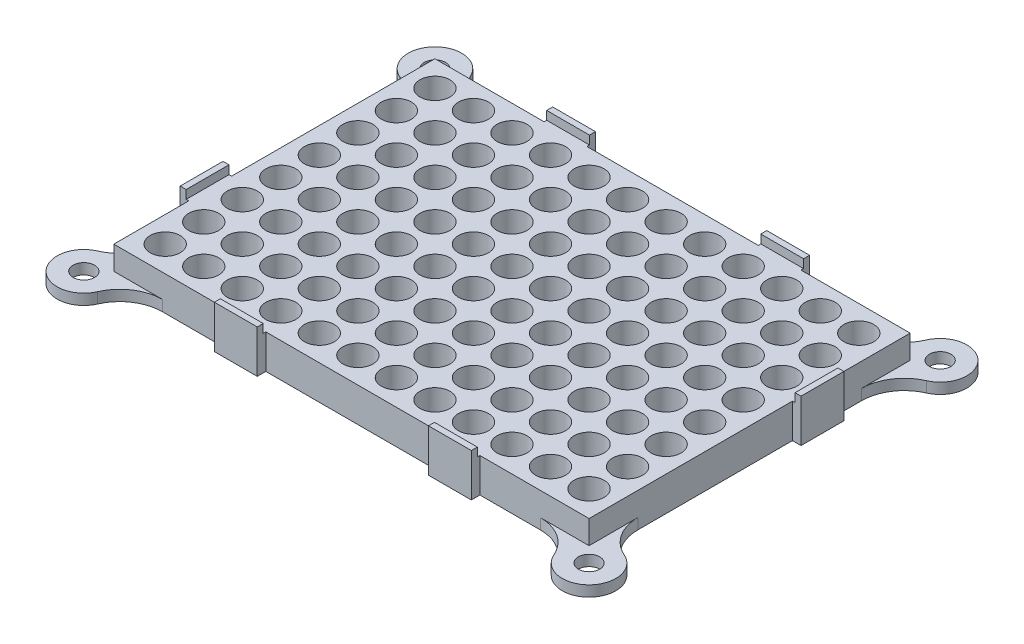
from build123d import *

# Parameters (mm, degrees)
SKETCH3_W              = 111
SKETCH3_H              = 75
SKETCH3_R              = 3.5
WELL_LIGHT_GUIDE_DEPTH = 8
SKETCH1_R              = 2.5
PCB_MOUNT_PLATE_DEPTH  = 2.5
SKETCH4_W              = 10
SKETCH4_H              = 2
SKETCH4_W_2            = 2
SKETCH4_H_2            = 10
TOP_GUIDE_TABS_DEPTH   = 10
SKETCH5_W              = 10
SKETCH5_H              = 0.6
SKETCH5_W_2            = 0.6
SKETCH5_H_2            = 10
F_3DPRINT_SPACER_DEPTH = 158.843672664
FILLET1_R              = 10


with BuildPart() as part:
    # Sketch3 → Well light guide (new body)
    with BuildSketch(Plane(origin=(0, 0, 0), x_dir=(1, 0, 0), z_dir=(0, 1, 0))):
        with Locations((64, 43)):
            Rectangle(SKETCH3_W, SKETCH3_H)
        with Locations(Location((14.5, 74.5, 0), (0, 0, 270))):
            Circle(SKETCH3_R, mode=Mode.SUBTRACT)
        with Locations(Location((23.5, 74.5, 0), (0, 0, 270))):
            Circle(SKETCH3_R, mode=Mode.SUBTRACT)
        with Locations(Location((32.5, 74.5, 0), (0, 0, 270))):
            Circle(SKETCH3_R, mode=Mode.SUBTRACT)
        with Locations(Location((41.5, 74.5, 0), (0, 0, 270))):
            Circle(SKETCH3_R, mode=Mode.SUBTRACT)
        with Locations(Location((50.5, 74.5, 0), (0, 0, 270))):
            Circle(SKETCH3_R, mode=Mode.SUBTRACT)
        with Locations(Location((59.5, 74.5, 0), (0, 0, 270))):
            Circle(SKETCH3_R, mode=Mode.SUBTRACT)
        with Locations(Location((68.5, 74.5, 0), (0, 0, 270))):
            Circle(SKETCH3_R, mode=Mode.SUBTRACT)
        with Locations(Location((77.5, 74.5, 0), (0, 0, 270))):
            Circle(SKETCH3_R, mode=Mode.SUBTRACT)
        with Locations(Location((86.5, 74.5, 0), (0, 0, 270))):
            Circle(SKETCH3_R, mode=Mode.SUBTRACT)
        with Locations(Location((95.5, 74.5, 0), (0, 0, 270))):
            Circle(SKETCH3_R, mode=Mode.SUBTRACT)
        with Locations(Location((104.5, 74.5, 0), (0, 0, 270))):
            Circle(SKETCH3_R, mode=Mode.SUBTRACT)
        with Locations(Location((113.5, 74.5, 0), (0, 0, 270))):
            Circle(SKETCH3_R, mode=Mode.SUBTRACT)
        with Locations(Location((23.5, 65.5, 0), (0, 0, 270))):
            Circle(SKETCH3_R, mode=Mode.SUBTRACT)
        with Locations(Location((32.5, 65.5, 0), (0, 0, 270))):
            Circle(SKETCH3_R, mode=Mode.SUBTRACT)
        with Locations(Location((41.5, 65.5, 0), (0, 0, 270))):
            Circle(SKETCH3_R, mode=Mode.SUBTRACT)
        with Locations(Location((50.5, 65.5, 0), (0, 0, 270))):
            Circle(SKETCH3_R, mode=Mode.SUBTRACT)
        with Locations(Location((59.5, 65.5, 0), (0, 0, 270))):
            Circle(SKETCH3_R, mode=Mode.SUBTRACT)
        with Locations(Location((68.5, 65.5, 0), (0, 0, 270))):
            Circle(SKETCH3_R, mode=Mode.SUBTRACT)
        with Locations(Location((77.5, 65.5, 0), (0, 0, 270))):
            Circle(SKETCH3_R, mode=Mode.SUBTRACT)
        with Locations(Location((86.5, 65.5, 0), (0, 0, 270))):
            Circle(SKETCH3_R, mode=Mode.SUBTRACT)
        with Locations(Location((95.5, 65.5, 0), (0, 0, 270))):
            Circle(SKETCH3_R, mode=Mode.SUBTRACT)
        with Locations(Location((104.5, 65.5, 0), (0, 0, 270))):
            Circle(SKETCH3_R, mode=Mode.SUBTRACT)
        with Locations(Location((113.5, 65.5, 0), (0, 0, 270))):
            Circle(SKETCH3_R, mode=Mode.SUBTRACT)
        with Locations(Location((23.5, 56.5, 0), (0, 0, 270))):
            Circle(SKETCH3_R, mode=Mode.SUBTRACT)
        with Locations(Location((32.5, 56.5, 0), (0, 0, 270))):
            Circle(SKETCH3_R, mode=Mode.SUBTRACT)
        with Locations(Location((41.5, 56.5, 0), (0, 0, 270))):
            Circle(SKETCH3_R, mode=Mode.SUBTRACT)
        with Locations(Location((50.5, 56.5, 0), (0, 0, 270))):
            Circle(SKETCH3_R, mode=Mode.SUBTRACT)
        with Locations(Location((59.5, 56.5, 0), (0, 0, 270))):
            Circle(SKETCH3_R, mode=Mode.SUBTRACT)
        with Locations(Location((68.5, 56.5, 0), (0, 0, 270))):
            Circle(SKETCH3_R, mode=Mode.SUBTRACT)
        with Locations(Location((77.5, 56.5, 0), (0, 0, 270))):
            Circle(SKETCH3_R, mode=Mode.SUBTRACT)
        with Locations(Location((86.5, 56.5, 0), (0, 0, 270))):
            Circle(SKETCH3_R, mode=Mode.SUBTRACT)
        with Locations(Location((95.5, 56.5, 0), (0, 0, 270))):
            Circle(SKETCH3_R, mode=Mode.SUBTRACT)
        with Locations(Location((104.5, 56.5, 0), (0, 0, 270))):
            Circle(SKETCH3_R, mode=Mode.SUBTRACT)
        with Locations(Location((113.5, 56.5, 0), (0, 0, 270))):
            Circle(SKETCH3_R, mode=Mode.SUBTRACT)
        with Locations(Location((23.5, 47.5, 0), (0, 0, 270))):
            Circle(SKETCH3_R, mode=Mode.SUBTRACT)
        with Locations(Location((32.5, 47.5, 0), (0, 0, 270))):
            Circle(SKETCH3_R, mode=Mode.SUBTRACT)
        with Locations(Location((41.5, 47.5, 0), (0, 0, 270))):
            Circle(SKETCH3_R, mode=Mode.SUBTRACT)
        with Locations(Location((50.5, 47.5, 0), (0, 0, 270))):
            Circle(SKETCH3_R, mode=Mode.SUBTRACT)
        with Locations(Location((59.5, 47.5, 0), (0, 0, 270))):
            Circle(SKETCH3_R, mode=Mode.SUBTRACT)
        with Locations(Location((68.5, 47.5, 0), (0, 0, 270))):
            Circle(SKETCH3_R, mode=Mode.SUBTRACT)
        with Locations(Location((77.5, 47.5, 0), (0, 0, 270))):
            Circle(SKETCH3_R, mode=Mode.SUBTRACT)
        with Locations(Location((86.5, 47.5, 0), (0, 0, 270))):
            Circle(SKETCH3_R, mode=Mode.SUBTRACT)
        with Locations(Location((95.5, 47.5, 0), (0, 0, 270))):
            Circle(SKETCH3_R, mode=Mode.SUBTRACT)
        with Locations(Location((104.5, 47.5, 0), (0, 0, 270))):
            Circle(SKETCH3_R, mode=Mode.SUBTRACT)
        with Locations(Location((113.5, 47.5, 0), (0, 0, 270))):
            Circle(SKETCH3_R, mode=Mode.SUBTRACT)
        with Locations(Location((23.5, 38.5, 0), (0, 0, 270))):
            Circle(SKETCH3_R, mode=Mode.SUBTRACT)
        with Locations(Location((32.5, 38.5, 0), (0, 0, 270))):
            Circle(SKETCH3_R, mode=Mode.SUBTRACT)
        with Locations(Location((41.5, 38.5, 0), (0, 0, 270))):
            Circle(SKETCH3_R, mode=Mode.SUBTRACT)
        with Locations(Location((50.5, 38.5, 0), (0, 0, 270))):
            Circle(SKETCH3_R, mode=Mode.SUBTRACT)
        with Locations(Location((59.5, 38.5, 0), (0, 0, 270))):
            Circle(SKETCH3_R, mode=Mode.SUBTRACT)
        with Locations(Location((68.5, 38.5, 0), (0, 0, 270))):
            Circle(SKETCH3_R, mode=Mode.SUBTRACT)
        with Locations(Location((77.5, 38.5, 0), (0, 0, 270))):
            Circle(SKETCH3_R, mode=Mode.SUBTRACT)
        with Locations(Location((86.5, 38.5, 0), (0, 0, 270))):
            Circle(SKETCH3_R, mode=Mode.SUBTRACT)
        with Locations(Location((95.5, 38.5, 0), (0, 0, 270))):
            Circle(SKETCH3_R, mode=Mode.SUBTRACT)
        with Locations(Location((104.5, 38.5, 0), (0, 0, 270))):
            Circle(SKETCH3_R, mode=Mode.SUBTRACT)
        with Locations(Location((113.5, 38.5, 0), (0, 0, 270))):
            Circle(SKETCH3_R, mode=Mode.SUBTRACT)
        with Locations(Location((23.5, 29.5, 0), (0, 0, 270))):
            Circle(SKETCH3_R, mode=Mode.SUBTRACT)
        with Locations(Location((32.5, 29.5, 0), (0, 0, 270))):
            Circle(SKETCH3_R, mode=Mode.SUBTRACT)
        with Locations(Location((41.5, 29.5, 0), (0, 0, 270))):
            Circle(SKETCH3_R, mode=Mode.SUBTRACT)
        with Locations(Location((50.5, 29.5, 0), (0, 0, 270))):
            Circle(SKETCH3_R, mode=Mode.SUBTRACT)
        with Locations(Location((59.5, 29.5, 0), (0, 0, 270))):
            Circle(SKETCH3_R, mode=Mode.SUBTRACT)
        with Locations(Location((68.5, 29.5, 0), (0, 0, 270))):
            Circle(SKETCH3_R, mode=Mode.SUBTRACT)
        with Locations(Location((77.5, 29.5, 0), (0, 0, 270))):
            Circle(SKETCH3_R, mode=Mode.SUBTRACT)
        with Locations(Location((86.5, 29.5, 0), (0, 0, 270))):
            Circle(SKETCH3_R, mode=Mode.SUBTRACT)
        with Locations(Location((95.5, 29.5, 0), (0, 0, 270))):
            Circle(SKETCH3_R, mode=Mode.SUBTRACT)
        with Locations(Location((104.5, 29.5, 0), (0, 0, 270))):
            Circle(SKETCH3_R, mode=Mode.SUBTRACT)
        with Locations(Location((113.5, 29.5, 0), (0, 0, 270))):
            Circle(SKETCH3_R, mode=Mode.SUBTRACT)
        with Locations(Location((23.5, 20.5, 0), (0, 0, 270))):
            Circle(SKETCH3_R, mode=Mode.SUBTRACT)
        with Locations(Location((32.5, 20.5, 0), (0, 0, 270))):
            Circle(SKETCH3_R, mode=Mode.SUBTRACT)
        with Locations(Location((41.5, 20.5, 0), (0, 0, 270))):
            Circle(SKETCH3_R, mode=Mode.SUBTRACT)
        with Locations(Location((50.5, 20.5, 0), (0, 0, 270))):
            Circle(SKETCH3_R, mode=Mode.SUBTRACT)
        with Locations(Location((59.5, 20.5, 0), (0, 0, 270))):
            Circle(SKETCH3_R, mode=Mode.SUBTRACT)
        with Locations(Location((68.5, 20.5, 0), (0, 0, 270))):
            Circle(SKETCH3_R, mode=Mode.SUBTRACT)
        with Locations(Location((77.5, 20.5, 0), (0, 0, 270))):
            Circle(SKETCH3_R, mode=Mode.SUBTRACT)
        with Locations(Location((86.5, 20.5, 0), (0, 0, 270))):
            Circle(SKETCH3_R, mode=Mode.SUBTRACT)
        with Locations(Location((95.5, 20.5, 0), (0, 0, 270))):
            Circle(SKETCH3_R, mode=Mode.SUBTRACT)
        with Locations(Location((104.5, 20.5, 0), (0, 0, 270))):
            Circle(SKETCH3_R, mode=Mode.SUBTRACT)
        with Locations(Location((113.5, 20.5, 0), (0, 0, 270))):
            Circle(SKETCH3_R, mode=Mode.SUBTRACT)
        with Locations(Location((23.5, 11.5, 0), (0, 0, 270))):
            Circle(SKETCH3_R, mode=Mode.SUBTRACT)
        with Locations(Location((32.5, 11.5, 0), (0, 0, 270))):
            Circle(SKETCH3_R, mode=Mode.SUBTRACT)
        with Locations(Location((41.5, 11.5, 0), (0, 0, 270))):
            Circle(SKETCH3_R, mode=Mode.SUBTRACT)
        with Locations(Location((50.5, 11.5, 0), (0, 0, 270))):
            Circle(SKETCH3_R, mode=Mode.SUBTRACT)
        with Locations(Location((59.5, 11.5, 0), (0, 0, 270))):
            Circle(SKETCH3_R, mode=Mode.SUBTRACT)
        with Locations(Location((68.5, 11.5, 0), (0, 0, 270))):
            Circle(SKETCH3_R, mode=Mode.SUBTRACT)
        with Locations(Location((77.5, 11.5, 0), (0, 0, 270))):
            Circle(SKETCH3_R, mode=Mode.SUBTRACT)
        with Locations(Location((86.5, 11.5, 0), (0, 0, 270))):
            Circle(SKETCH3_R, mode=Mode.SUBTRACT)
        with Locations(Location((95.5, 11.5, 0), (0, 0, 270))):
            Circle(SKETCH3_R, mode=Mode.SUBTRACT)
        with Locations(Location((104.5, 11.5, 0), (0, 0, 270))):
            Circle(SKETCH3_R, mode=Mode.SUBTRACT)
        with Locations(Location((113.5, 11.5, 0), (0, 0, 270))):
            Circle(SKETCH3_R, mode=Mode.SUBTRACT)
        with Locations(Location((14.5, 65.5, 0), (0, 0, 270))):
            Circle(SKETCH3_R, mode=Mode.SUBTRACT)
        with Locations(Location((14.5, 56.5, 0), (0, 0, 270))):
            Circle(SKETCH3_R, mode=Mode.SUBTRACT)
        with Locations(Location((14.5, 47.5, 0), (0, 0, 270))):
            Circle(SKETCH3_R, mode=Mode.SUBTRACT)
        with Locations(Location((14.5, 38.5, 0), (0, 0, 270))):
            Circle(SKETCH3_R, mode=Mode.SUBTRACT)
        with Locations(Location((14.5, 29.5, 0), (0, 0, 270))):
            Circle(SKETCH3_R, mode=Mode.SUBTRACT)
        with Locations(Location((14.5, 20.5, 0), (0, 0, 270))):
            Circle(SKETCH3_R, mode=Mode.SUBTRACT)
        with Locations(Location((14.5, 11.5, 0), (0, 0, 270))):
            Circle(SKETCH3_R, mode=Mode.SUBTRACT)
    extrude(amount=WELL_LIGHT_GUIDE_DEPTH)

    # Sketch1 → PCB mount plate (add)
    # profile 1 of 4: a face of its own
    with BuildSketch(Plane(origin=(0, 0, 0), x_dir=(1, 0, 0), z_dir=(0, 1, 0))):
        with BuildLine():
            Line((116.75, 84), (116.75, 80.5))
            Line((116.75, 80.5), (119.5, 80.5))
            Line((119.5, 80.5), (119.5, 77.75))
            Line((119.5, 77.75), (123, 77.75))
            ThreePointArc((123, 77.75), (127.419417382, 88.419417382), (116.75, 84))
        make_face()
        with Locations(Location((123, 84, 0), (0, 0, 270))):
            Circle(SKETCH1_R, mode=Mode.SUBTRACT)
    # profile 2 of 4: a face of its own
    with BuildSketch(Plane(origin=(0, 0, 0), x_dir=(1, 0, 0), z_dir=(0, 1, 0))):
        with BuildLine():
            Line((11.25, 84), (11.25, 80.5))
            Line((11.25, 80.5), (8.5, 80.5))
            Line((8.5, 80.5), (8.5, 77.75))
            Line((8.5, 77.75), (5, 77.75))
            ThreePointArc((5, 77.75), (0.580582618, 88.419417382), (11.25, 84))
        make_face()
        with Locations(Location((5, 84, 0), (0, 0, 90))):
            Circle(SKETCH1_R, mode=Mode.SUBTRACT)
    # profile 3 of 4: a face of its own
    with BuildSketch(Plane(origin=(0, 0, 0), x_dir=(1, 0, 0), z_dir=(0, 1, 0))):
        with BuildLine():
            Line((11.25, 2), (11.25, 5.5))
            Line((11.25, 5.5), (8.5, 5.5))
            Line((8.5, 5.5), (8.5, 8.25))
            Line((8.5, 8.25), (5, 8.25))
            ThreePointArc((5, 8.25), (0.580582618, -2.419417382), (11.25, 2))
        make_face()
        with Locations(Location((5, 2, 0), (0, 0, 270))):
            Circle(SKETCH1_R, mode=Mode.SUBTRACT)
    # profile 4 of 4: a face of its own
    with BuildSketch(Plane(origin=(0, 0, 0), x_dir=(1, 0, 0), z_dir=(0, 1, 0))):
        with BuildLine():
            Line((119.5, 5.5), (116.75, 5.5))
            Line((116.75, 5.5), (116.75, 2))
            ThreePointArc((116.75, 2), (127.419417382, -2.419417382), (123, 8.25))
            Line((123, 8.25), (119.5, 8.25))
            Line((119.5, 8.25), (119.5, 5.5))
        make_face()
        with Locations(Location((123, 2, 0), (0, 0, 90))):
            Circle(SKETCH1_R, mode=Mode.SUBTRACT)
    extrude(amount=PCB_MOUNT_PLATE_DEPTH)

    # Sketch4 → Top guide tabs (add)
    with BuildSketch(Plane.XZ):
        with Locations((39, -81.5)):
            Rectangle(SKETCH4_W, SKETCH4_H)
        with Locations((89, -4.5)):
            Rectangle(SKETCH4_W, SKETCH4_H)
        with Locations((7.5, -28)):
            Rectangle(SKETCH4_W_2, SKETCH4_H_2)
        with Locations((120.5, -58)):
            Rectangle(SKETCH4_W_2, SKETCH4_H_2)
        with Locations((39, -4.5)):
            Rectangle(SKETCH4_W, SKETCH4_H)
        with Locations((89, -81.5)):
            Rectangle(SKETCH4_W, SKETCH4_H)
    extrude(amount=-TOP_GUIDE_TABS_DEPTH)

    # Sketch5 → 3Dprint spacer (cut, through all)
    with BuildSketch(Plane(origin=(0, 8, 0), x_dir=(1, 0, 0), z_dir=(0, 1, 0))):
        with Locations((89, 80.8)):
            Rectangle(SKETCH5_W, SKETCH5_H)
        with Locations((89, 5.2)):
            Rectangle(SKETCH5_W, SKETCH5_H)
        with Locations((119.8, 58)):
            Rectangle(SKETCH5_W_2, SKETCH5_H_2)
        with Locations((39, 80.8)):
            Rectangle(SKETCH5_W, SKETCH5_H)
        with Locations((39, 5.2)):
            Rectangle(SKETCH5_W, SKETCH5_H)
        with Locations((8.2, 28)):
            Rectangle(SKETCH5_W_2, SKETCH5_H_2)
    extrude(amount=F_3DPRINT_SPACER_DEPTH, mode=Mode.SUBTRACT)

    # Fillet1
    # the kernel refuses this fillet: 10 mm, written as the material it adds along each edge
    with BuildSketch(Plane(origin=(116.75, 0, -80.5), x_dir=(0.0866364142554912, 0, -0.9962399970513885), z_dir=(0, 1, 0)), Plane(origin=(119.5, 0, -8.25), x_dir=(0.9962399970513889, 0, 0.08663641425548835), z_dir=(0, 1, 0)), Plane(origin=(8.5, 0, -77.75), x_dir=(-0.9962399970513889, 0, -0.08663641425548871), z_dir=(0, 1, 0))) as fillet1_piece_1:
        with BuildLine():
            CenterArc((9.213569299, 9.477236051), FILLET1_R, 184.970131688, 66.421821522)
            Line((-0.748830671, 8.610871908), (-1.745070668, 8.524235494))
            Line((-1.745070668, 8.524235494), (-0.996239997, -0.086636414))
            Line((-0.996239997, -0.086636414), (0.086636414, -0.996239997))
            ThreePointArc((0.086636414, -0.996239997), (3.573476404, -0.693012547), (5.70355275, -0.947723605))
            Line((5.70355275, -0.947723605), (6.022645164, 0))
        make_face()
    extrude(amount=2.5)
    with BuildSketch(Plane(origin=(119.5, 0, -77.75), x_dir=(0, 0, 1), z_dir=(0, 1, 0)), Plane(origin=(116.75, 0, -5.5), x_dir=(-1, 0, 0), z_dir=(0, 1, 0)), Plane(origin=(8.5, 0, -8.25), x_dir=(0, 0, -1), z_dir=(0, 1, 0)), Plane(origin=(11.25, 0, -80.5), x_dir=(1, 0, 0), z_dir=(0, 1, 0))) as fillet1_piece_2:
        with BuildLine():
            CenterArc((8.643371009, 10), FILLET1_R, 203.578178478, 66.421821522)
            Line((-0.521780381, 6), (-1.43829552, 5.6))
            ThreePointArc((-1.43829552, 5.6), (-1, 3.5), (-1, 0))
            Line((-1, 0), (0, -1))
            Line((0, -1), (8.643371009, -1))
            Line((8.643371009, -1), (8.643371009, 0))
        make_face()
    extrude(amount=2.5)
    with BuildSketch(Plane(origin=(11.25, 0, -5.5), x_dir=(1, 0, 0), z_dir=(0, 1, 0))) as fillet1_piece_3:
        with BuildLine():
            CenterArc((8.643371009, -10), FILLET1_R, 90, 66.421821522)
            Line((-0.521780381, -6), (-1.43829552, -5.6))
            ThreePointArc((-1.43829552, -5.6), (-1, -3.5), (-1, 0))
            Line((-1, 0), (0, 1))
            Line((0, 1), (8.643371009, 1))
            Line((8.643371009, 1), (8.643371009, 0))
        make_face()
    extrude(amount=2.5)


solid = part.part
